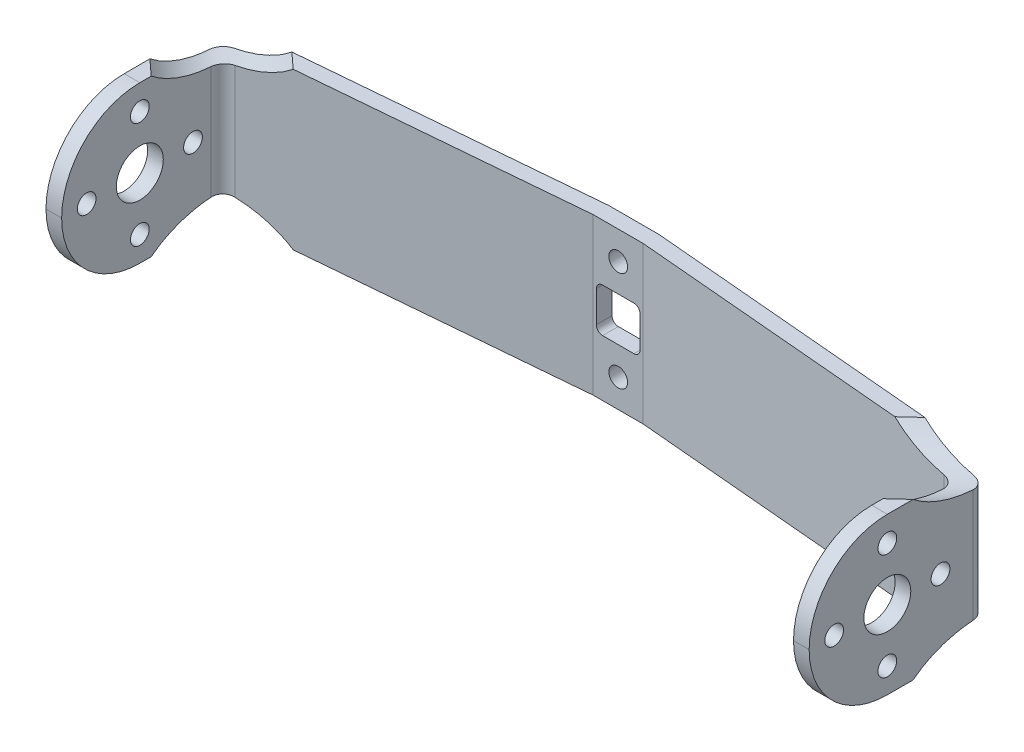
from build123d import *

# Parameters (mm, degrees)
RESSALTO_EXTRUS_O1_DEPTH = 25
FILETE1_R                = 12.5
FILETE2_R                = 2
ESBO_O2_R                = 1.5
CORTE_EXTRUS_O1_DEPTH    = 10
ESBO_O3_R                = 3.75
ESBO_O3_R_2              = 1.5
CORTE_EXTRUS_O2_DEPTH    = 131.832972904
ESBO_O4_R                = 11
CORTE_EXTRUS_O5_DEPTH    = 17


with BuildPart() as part:
    # Esboço1 → Ressalto-extrusão1 (new body)
    with BuildSketch(Plane(origin=(0, 0, 0), x_dir=(1, 0, 0), z_dir=(0, 1, 0))):
        Polygon((-83.493030157, -40.103201854), (-85.993030157, -40.103201854), (-85.993030157, -12.103201854), (-28.993030157, -7.116348033), (-20.993030157, -7.116348033), (36.006969843, -12.103201854), (36.006969843, -40.103201854), (33.506969843, -40.103201854), (33.506969843, -14.394029789), (-20.993030157, -9.625897627), (-28.993030157, -9.625897627), (-83.493030157, -14.394029789), align=None)
    extrude(amount=RESSALTO_EXTRUS_O1_DEPTH)

    # Filete1
    filete1_edges = [part.edges().sort_by_distance(p)[0] for p in [
        (34.756969843, 25, 40.103201854),
        (34.756969843, 0, 40.103201854),
        (-84.743030157, 0, 40.103201854),
        (-84.743030157, 25, 40.103201854),
    ]]
    fillet(filete1_edges, radius=FILETE1_R - 0.0001)  # a hair under: the kernel refuses the full size

    # Filete2
    filete2_edges = [part.edges().sort_by_distance(p)[0] for p in [
        (-85.993030157, 12.5, 12.103201854),
        (36.006969843, 12.5, 12.103201854),
        (33.506969843, 12.5, 14.394029789),
        (-83.493030157, 12.5, 14.394029789),
    ]]
    fillet(filete2_edges, radius=FILETE2_R)

    # Esboço2 → Corte-extrusão1 (cut)
    with BuildSketch(Plane(origin=(0, 0, 7.116348033), x_dir=(-1, 0, 0), z_dir=(0, 0, -1))):
        with Locations((24.993030157, 4.5)):
            Circle(ESBO_O2_R)
        with Locations((24.993030157, 20.5)):
            Circle(ESBO_O2_R)
        with BuildLine():
            Line((27.493030157, 9), (22.493030157, 9))
            ThreePointArc((22.493030157, 9), (21.785923376, 9.292893219), (21.493030157, 10))
            Line((21.493030157, 10), (21.493030157, 15))
            ThreePointArc((21.493030157, 15), (21.785923376, 15.707106781), (22.493030157, 16))
            Line((22.493030157, 16), (27.493030157, 16))
            ThreePointArc((27.493030157, 16), (28.200136938, 15.707106781), (28.493030157, 15))
            Line((28.493030157, 15), (28.493030157, 10))
            ThreePointArc((28.493030157, 10), (28.200136938, 9.292893219), (27.493030157, 9))
        make_face()
    extrude(amount=-CORTE_EXTRUS_O1_DEPTH, mode=Mode.SUBTRACT)

    # Esboço3 → Corte-extrusão2 (cut, through all)
    with BuildSketch(Plane(origin=(36.006969843, 0, 0), x_dir=(0, 0, -1), z_dir=(1, 0, 0))):
        with Locations((-27.603201854, 12.5)):
            Circle(ESBO_O3_R)
        with Locations((-36.103201854, 12.5)):
            Circle(ESBO_O3_R_2)
        with Locations((-19.103201854, 12.5)):
            Circle(ESBO_O3_R_2)
        with Locations((-27.603201854, 4)):
            Circle(ESBO_O3_R_2)
        with Locations((-27.603201854, 21)):
            Circle(ESBO_O3_R_2)
    extrude(amount=-CORTE_EXTRUS_O2_DEPTH, mode=Mode.SUBTRACT)

    # Esboço4 → Corte-extrusão5 (cut, symmetric)
    with BuildSketch(Plane(origin=(-39.80249127, 0, -36.472263554), x_dir=(0.6755902076156622, 0, -0.7372773368101223), z_dir=(0.7372773368101223, 0, 0.6755902076156622))):
        with Locations((-67.370645943, 32.5)):
            Circle(ESBO_O4_R)
        with Locations((-67.370645943, -7.5)):
            Circle(ESBO_O4_R)
    corte_extrus_o5 = extrude(amount=CORTE_EXTRUS_O5_DEPTH, both=True, mode=Mode.SUBTRACT)

    # Espelhar1: Corte-extrusão5 across plane
    add(corte_extrus_o5.mirror(Plane(origin=(-24.993030157, 0, 0), x_dir=(0, 0, 1), z_dir=(1, 0, 0))), mode=Mode.SUBTRACT)


solid = part.part
